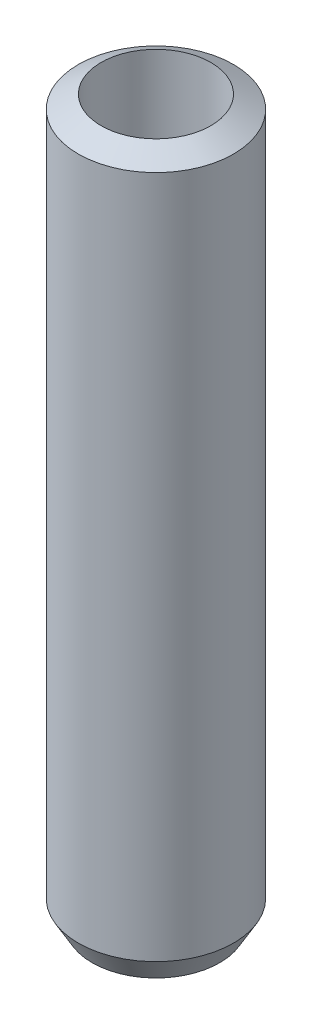
from build123d import *

# Parameters (mm, degrees)
SKETCH1_R           = 20
BOSS_EXTRUDE1_DEPTH = 185.818911
SKETCH2_R           = 14.135189885
CUT_EXTRUDE1_DEPTH  = 188.959218144
CHAMFER1_SIZE       = 3.563148
CHAMFER1_SIZE_2     = 6.171554


with BuildPart() as part:
    # Sketch1 → Boss-Extrude1 (new body)
    with BuildSketch(Plane(origin=(0, 0, 0), x_dir=(1, 0, 0), z_dir=(0, 1, 0))):
        with Locations(Location((0, 0, 0), (0, 0, 270))):
            Circle(SKETCH1_R)
    extrude(amount=BOSS_EXTRUDE1_DEPTH)

    # Sketch2 → Cut-Extrude1 (cut, through all)
    with BuildSketch(Plane(origin=(0, 0, 0), x_dir=(1, 0, 0), z_dir=(0, 1, 0))):
        with Locations(Location((0, 0, 0), (0, 0, 270))):
            Circle(SKETCH2_R)
    extrude(amount=CUT_EXTRUDE1_DEPTH, mode=Mode.SUBTRACT)

    # Chamfer1
    # the kernel refuses this chamfer: 6.171554, 3.563148 mm, written as the material it takes off along each edge
    with BuildSketch(Plane(origin=(0, 185.818911, 0), x_dir=(0, 0, 1), z_dir=(-1, 0, 0))) as chamfer1_piece_1:
        Polygon((20, -CHAMFER1_SIZE), (20 - CHAMFER1_SIZE_2, 0), (20, 0), align=None)
    revolve(axis=Axis((0, 185.818911, 0), (0, 1, 0)), mode=Mode.SUBTRACT)
    with BuildSketch(Plane(origin=(0, 0, 0), x_dir=(0, 0, 1), z_dir=(-1, 0, 0))) as chamfer1_piece_2:
        Polygon((20, CHAMFER1_SIZE_2), (20 - CHAMFER1_SIZE, 0), (20, 0), align=None)
    revolve(axis=Axis((0, 0, 0), (0, 1, 0)), mode=Mode.SUBTRACT)


solid = part.part
